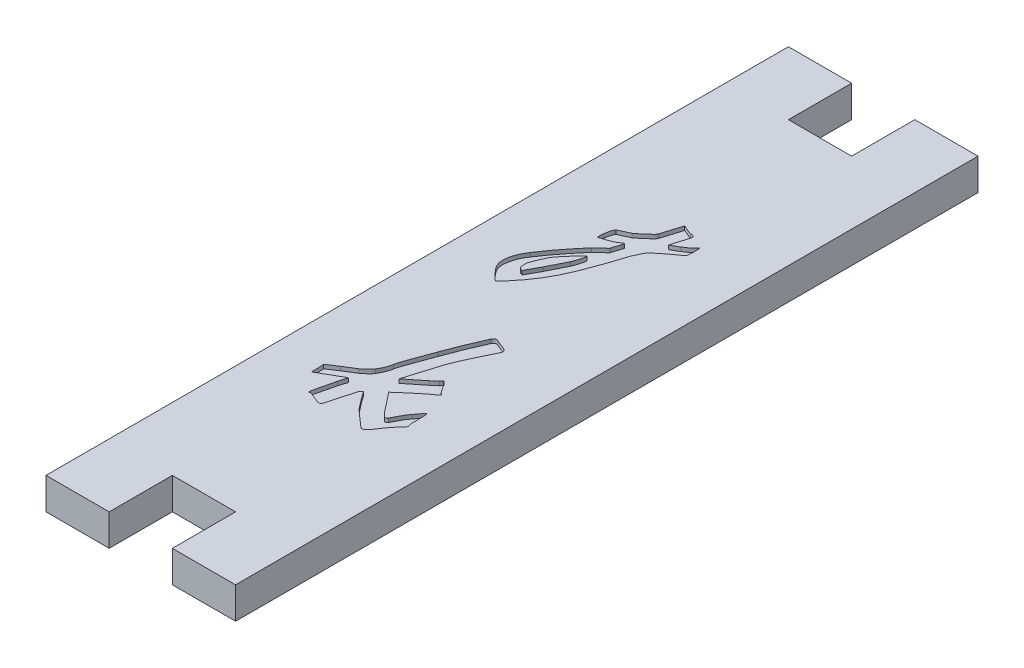
from build123d import *

# Parameters (mm, degrees)
SKETCH_1_W          = 24
SKETCH_1_H          = 94
EXTRUDE_1_DEPTH     = 4
SKETCH_2_W          = 8
SKETCH_2_H          = 8
CUT_EXTRUDE_1_DEPTH = 49.672374095
SKETCH_3_W          = 8
SKETCH_3_H          = 8
CUT_EXTRUDE_2_DEPTH = 49.672374095
THICKEN_START       = 3.5
THICKEN_1_DEPTH     = 0.5
THICKEN_1_2_DEPTH   = 0.5
THICKEN_2_DEPTH     = 0.5


# Read off the part's stored shape, not the designer's step: 除料-厚面1, 厚面1, 除料-厚面2
with BuildPart() as part:
    # 草圖1 → 填料-伸長1 (new body)
    with BuildSketch(Plane(origin=(0, 4, 0), x_dir=(1, 0, 0), z_dir=(0, 1, 0))):
        Rectangle(SKETCH_1_W, SKETCH_1_H)
    extrude(amount=-EXTRUDE_1_DEPTH)

    # 草圖2 → 除料-伸長1 (cut, through all)
    with BuildSketch(Plane.XZ):
        with Locations((0, -43)):
            Rectangle(SKETCH_2_W, SKETCH_2_H)
    extrude(amount=-CUT_EXTRUDE_1_DEPTH, mode=Mode.SUBTRACT)

    # 草圖3 → 除料-伸長2 (cut, through all)
    with BuildSketch(Plane.XZ):
        with Locations((0, 43)):
            Rectangle(SKETCH_3_W, SKETCH_3_H)
    extrude(amount=-CUT_EXTRUDE_2_DEPTH, mode=Mode.SUBTRACT)

    # Thicken 1 outline → Thicken 1 (cut)
    with BuildSketch(Plane(origin=(0, 0, 0), x_dir=(1, 0, 0), z_dir=(0, 1, 0)).offset(THICKEN_START)):
        with BuildLine():
            add(Edge.make_bspline(
                [(-6.355501814, 4.359129383), (-6.396964695, 4.429641782), (-6.490705603, 4.589058979), (-6.607213892, 4.87628821), (-6.682323732, 5.240280014), (-6.686608044, 5.589572198), (-6.659611427, 5.899764075), (-6.613103157, 6.159630598), (-6.552451609, 6.438590561), (-6.468428857, 6.737134296), (-6.357637131, 7.056471783), (-6.197448135, 7.386617717), (-6.009152613, 7.740262462), (-5.857995764, 7.973302873), (-5.778718259, 8.095525998)],
                knots=[0, 0, 0, 0, 0.061464226, 0.138960733, 0.231864936, 0.339186412, 0.400347276, 0.465816726, 0.53751186, 0.614944337, 0.698917175, 0.79125015, 0.890516589, 1, 1, 1, 1], degree=3))
            add(Edge.make_bspline(
                [(-4.875453446, 2.802902056), (-4.887759621, 2.806013638), (-4.919072047, 2.813930899), (-4.971174126, 2.848356063), (-5.043204711, 2.897877043), (-5.167730755, 2.9999646), (-5.345068535, 3.157591897), (-5.560553246, 3.383146756), (-5.778697744, 3.634841778), (-6.000920585, 3.883833782), (-6.195574389, 4.12455497), (-6.305599255, 4.285934536), (-6.355501814, 4.359129383)],
                knots=[0, 0, 0, 0, 0.017504993, 0.044540553, 0.085473388, 0.139153155, 0.267394076, 0.414426075, 0.571210807, 0.729254587, 0.877201495, 1, 1, 1, 1], degree=3))
            add(Edge.make_bspline(
                [(-1.53808948, 7.366384522), (-1.706491203, 7.043403536), (-2.035186776, 6.412991816), (-2.50249307, 5.674043667), (-2.878157375, 5.127060114), (-3.1445816, 4.751525298), (-3.402408942, 4.404780452), (-3.652005084, 4.092565304), (-3.884548983, 3.807649108), (-4.100042025, 3.556253816), (-4.297710464, 3.335420527), (-4.474764512, 3.150800648), (-4.62539466, 3.004800044), (-4.738038152, 2.897753476), (-4.815312887, 2.830715332), (-4.860685257, 2.809731918), (-4.875453446, 2.802902056)],
                knots=[0, 0, 0, 0, 0.192058031, 0.37486923, 0.460670631, 0.54208073, 0.617725062, 0.688547785, 0.752900218, 0.811703363, 0.86318847, 0.909199264, 0.946634941, 0.973709942, 0.991442886, 1, 1, 1, 1], degree=3))
            add(Edge.make_bspline(
                [(0.214026602, 11.704957678), (0.090993183, 11.356147322), (-0.165465463, 10.629064939), (-0.586767093, 9.531147171), (-1.02727134, 8.424166151), (-1.370786044, 7.712829738), (-1.53808948, 7.366384522)],
                knots=[0, 0, 0, 0, 0.236986622, 0.493989915, 0.753555744, 1, 1, 1, 1], degree=3))
            add(Edge.make_bspline(
                [(0.968561064, 14.037484885), (0.849535813, 13.649931707), (0.609597883, 12.868679776), (0.346573374, 12.094893992), (0.214026602, 11.704957678)],
                knots=[0, 0, 0, 0, 0.496066843, 1, 1, 1, 1], degree=3))
            add(Edge.make_bspline(
                [(1.218863362, 14.563482467), (1.176651309, 14.473950261), (1.093845672, 14.298318637), (1.009774868, 14.12328913), (0.968561064, 14.037484885)],
                knots=[0, 0, 0, 0, 0.509772688, 1, 1, 1, 1], degree=3))
            add(Edge.make_bspline(
                [(1.643288996, 15.415961306), (1.567888193, 15.28800753), (1.406365118, 15.013905842), (1.284069825, 14.720123748), (1.218863362, 14.563482467)],
                knots=[0, 0, 0, 0, 0.466811337, 1, 1, 1, 1], degree=3))
            add(Edge.make_bspline(
                [(3.148730351, 16.671100363), (2.984829608, 16.547396061), (2.662950134, 16.304457104), (2.280417729, 15.996859971), (2.003015275, 15.7725801), (1.843084807, 15.631282794), (1.725014504, 15.517538078), (1.666987359, 15.445416041), (1.643288996, 15.415961306)],
                knots=[0, 0, 0, 0, 0.313735315, 0.61613484, 0.750032602, 0.858665321, 0.942278731, 1, 1, 1, 1], degree=3))
            add(Edge.make_bspline(
                [(4.454655381, 17.621523579), (4.227892611, 17.460376924), (3.78900439, 17.148485475), (3.357356414, 16.826650909), (3.148730351, 16.671100363)],
                knots=[0, 0, 0, 0, 0.516675453, 1, 1, 1, 1], degree=3))
            add(Edge.make_bspline(
                [(4.353083434, 19.203143894), (4.365584965, 19.226966086), (4.384919812, 19.263809451), (4.441194248, 19.316120282), (4.480751486, 19.253591234), (4.49918412, 19.138425127), (4.527846222, 18.916669042), (4.528014888, 18.616072783), (4.523019604, 18.283613598), (4.5045242, 18.01242126), (4.495477891, 17.818915499), (4.476010226, 17.719028044), (4.472755816, 17.654202047), (4.458613172, 17.628668963), (4.454655381, 17.621523579)],
                knots=[0, 0, 0, 0, 0.047164453, 0.072944466, 0.096753549, 0.141841484, 0.277220848, 0.451262612, 0.637164929, 0.819339156, 0.896679195, 0.952603895, 0.986736293, 1, 1, 1, 1], degree=3))
            add(Edge.make_bspline(
                [(3.148730351, 18.223700121), (3.279099193, 18.306896722), (3.532031814, 18.468309019), (3.827878365, 18.685784426), (4.041194803, 18.855328752), (4.169839866, 18.977646376), (4.275129682, 19.090159134), (4.328466604, 19.167464705), (4.353083434, 19.203143894)],
                knots=[0, 0, 0, 0, 0.296934427, 0.576091657, 0.704847483, 0.819841485, 0.916850629, 1, 1, 1, 1], degree=3))
            add(Edge.make_bspline(
                [(2.147521161, 17.646916566), (2.323575928, 17.743608954), (2.661240682, 17.929060403), (2.990935068, 18.12832834), (3.148730351, 18.223700121)],
                knots=[0, 0, 0, 0, 0.521389231, 1, 1, 1, 1], degree=3))
            add(Edge.make_bspline(
                [(2.372430472, 18.423216445), (2.338121909, 18.296032144), (2.267944258, 18.035878562), (2.188252887, 17.778478482), (2.147521161, 17.646916566)],
                knots=[0, 0, 0, 0, 0.488881604, 1, 1, 1, 1], degree=3))
            add(Edge.make_bspline(
                [(2.77146312, 19.729141475), (2.738216951, 19.631388811), (2.6675251, 19.423535785), (2.570805342, 19.09827322), (2.471393346, 18.760639468), (2.405059605, 18.534468476), (2.372430472, 18.423216445)],
                knots=[0, 0, 0, 0, 0.22679583, 0.482239539, 0.745317015, 1, 1, 1, 1], degree=3))
            add(Edge.make_bspline(
                [(2.270858525, 20.30592503), (2.307027401, 20.298908891), (2.381325741, 20.284496292), (2.495894074, 20.281269505), (2.60754941, 20.273850249), (2.708123952, 20.247672393), (2.792873311, 20.189554354), (2.833073243, 20.078147149), (2.825147792, 19.919523124), (2.791727394, 19.801004556), (2.77146312, 19.729141475)],
                knots=[0, 0, 0, 0, 0.109552069, 0.225042573, 0.340813598, 0.442248243, 0.532299489, 0.633989637, 0.778071631, 1, 1, 1, 1], degree=3))
            add(Edge.make_bspline(
                [(1.066505441, 20.755743652), (1.078394603, 20.764624321), (1.123491516, 20.798309688), (1.236800829, 20.721551605), (1.383100762, 20.67505288), (1.56203513, 20.588996971), (1.751209944, 20.502808464), (1.936868916, 20.40476984), (2.109745793, 20.328465436), (2.223228075, 20.312588747), (2.270858525, 20.30592503)],
                knots=[0, 0, 0, 0, 0.032378655, 0.122815842, 0.258436103, 0.407565156, 0.570265885, 0.737890626, 0.889988223, 1, 1, 1, 1], degree=3))
            add(Edge.make_bspline(
                [(0.315598549, 18.299879081), (0.325050002, 18.333803159), (0.346409026, 18.410467052), (0.387713096, 18.53664313), (0.434204695, 18.690792698), (0.512295263, 18.932418037), (0.618930546, 19.255254025), (0.737907516, 19.648410199), (0.855311078, 20.022846047), (0.94552102, 20.31282673), (1.005149303, 20.512612015), (1.03836806, 20.623344095), (1.057994607, 20.700857063), (1.064250583, 20.741202013), (1.066505441, 20.755743652)],
                knots=[0, 0, 0, 0, 0.041123604, 0.092933864, 0.155022078, 0.22915871, 0.389484302, 0.552076421, 0.708854994, 0.847774622, 0.906749423, 0.952334963, 0.982819963, 1, 1, 1, 1], degree=3))
            add(Edge.make_bspline(
                [(-1.440145103, 16.645707376), (-1.387014209, 16.686917319), (-1.258206121, 16.786824805), (-1.03600765, 16.95451716), (-0.772139069, 17.159164741), (-0.49982224, 17.396656781), (-0.229031634, 17.636599328), (0.014427265, 17.868413205), (0.215397355, 18.077474031), (0.285876649, 18.233908803), (0.315598549, 18.299879081)],
                knots=[0, 0, 0, 0, 0.082974002, 0.201158344, 0.343550518, 0.494880313, 0.647053791, 0.789531943, 0.911243287, 1, 1, 1, 1], degree=3))
            Line((-1.440145103, 16.645707376), (-2.84401451, 15.992744861))
            add(Edge.make_bspline(
                [(-3.195888755, 14.788391778), (-3.177074742, 14.897349007), (-3.13932888, 15.115945898), (-3.074192657, 15.435897913), (-2.99026329, 15.737230253), (-2.890925619, 15.910785383), (-2.84401451, 15.992744861)],
                knots=[0, 0, 0, 0, 0.262525929, 0.526696136, 0.776487521, 1, 1, 1, 1], degree=3))
            add(Edge.make_bspline(
                [(-3.221281741, 14.012091898), (-3.22534503, 14.143989053), (-3.233333674, 14.403305985), (-3.208225891, 14.661515935), (-3.195888755, 14.788391778)],
                knots=[0, 0, 0, 0, 0.50863302, 1, 1, 1, 1], degree=3))
            add(Edge.make_bspline(
                [(-1.240628779, 14.788391778), (-1.327580877, 14.731628596), (-1.506171083, 14.615043161), (-1.802148162, 14.483408633), (-2.109435492, 14.372118835), (-2.405791492, 14.263409521), (-2.680379731, 14.17651472), (-2.910767377, 14.103183989), (-3.087990448, 14.056261978), (-3.183887737, 14.024483527), (-3.221281741, 14.012091898)],
                knots=[0, 0, 0, 0, 0.145681397, 0.299213836, 0.453505669, 0.605032546, 0.742561932, 0.858092831, 0.944664992, 1, 1, 1, 1], degree=3))
            add(Edge.make_bspline(
                [(-0.812575574, 14.839177751), (-0.800655951, 14.872439462), (-0.780708314, 14.928103344), (-0.767234849, 15.025221683), (-0.846806913, 15.043046994), (-0.932610841, 14.985166609), (-1.071759688, 14.906725782), (-1.178284056, 14.832079469), (-1.240628779, 14.788391778)],
                knots=[0, 0, 0, 0, 0.159084507, 0.266229873, 0.319258042, 0.45601908, 0.681628342, 1, 1, 1, 1], degree=3))
            add(Edge.make_bspline(
                [(-1.189842805, 13.660217654), (-1.178801259, 13.692814769), (-1.151929216, 13.772147048), (-1.110851983, 13.909196174), (-1.061598309, 14.072176342), (-1.012205552, 14.249481274), (-0.959481422, 14.426572001), (-0.904971769, 14.591590611), (-0.849019562, 14.72547937), (-0.823083673, 14.806394462), (-0.812575574, 14.839177751)],
                knots=[0, 0, 0, 0, 0.083373258, 0.202907239, 0.346569204, 0.495855602, 0.648776739, 0.794219706, 0.916626742, 1, 1, 1, 1], degree=3))
            add(Edge.make_bspline(
                [(-2.415961306, 12.481257557), (-2.375673558, 12.528002754), (-2.283400562, 12.635065557), (-2.111086984, 12.789836765), (-1.916511164, 12.958858232), (-1.718707164, 13.132049105), (-1.530781981, 13.294723678), (-1.368397809, 13.435913814), (-1.232778151, 13.541823636), (-1.201260404, 13.628733679), (-1.189842805, 13.660217654)],
                knots=[0, 0, 0, 0, 0.108147374, 0.247695208, 0.405516853, 0.560345802, 0.709190176, 0.840088713, 0.942070641, 1, 1, 1, 1], degree=3))
            add(Edge.make_bspline(
                [(-5.778718259, 8.095525998), (-5.614963707, 8.345918195), (-5.284236811, 8.851622817), (-4.756748484, 9.581410264), (-4.229891658, 10.274440351), (-3.802282785, 10.816175608), (-3.482573731, 11.212484586), (-3.259201189, 11.474774792), (-3.061985835, 11.720543896), (-2.877170248, 11.934111647), (-2.720280366, 12.121611227), (-2.589574808, 12.272839433), (-2.491294281, 12.388657066), (-2.437652714, 12.454594134), (-2.415961306, 12.481257557)],
                knots=[0, 0, 0, 0, 0.162259993, 0.327708409, 0.488268098, 0.634438927, 0.702044496, 0.764438419, 0.821291446, 0.872938895, 0.917615173, 0.953896129, 0.981356662, 1, 1, 1, 1], degree=3))
        make_face()
    extrude(amount=THICKEN_1_DEPTH, mode=Mode.SUBTRACT)

    # Thicken 1 2 outline → Thicken 1 2 (add)
    with BuildSketch(Plane(origin=(0, 0, 0), x_dir=(1, 0, 0), z_dir=(0, 1, 0)).offset(THICKEN_START)):
        with BuildLine():
            add(Edge.make_bspline(
                [(-2.216444982, 9.648125756), (-2.17552934, 9.749311061), (-2.093896964, 9.951189767), (-1.990875365, 10.257095254), (-1.903786067, 10.549079328), (-1.830334109, 10.811553984), (-1.780396913, 11.026608125), (-1.764589444, 11.180698198), (-1.767781094, 11.260543983), (-1.776784264, 11.306397188), (-1.814437117, 11.303229237), (-1.829493392, 11.289416528), (-1.839177751, 11.280532044)],
                knots=[0, 0, 0, 0, 0.183182449, 0.365474372, 0.541418149, 0.695048749, 0.821642748, 0.91536267, 0.945876205, 0.96586673, 0.978045111, 1, 1, 1, 1], degree=3))
            add(Edge.make_bspline(
                [(-1.839177751, 11.280532044), (-1.996406467, 11.114905306), (-2.306156211, 10.788610969), (-2.615509659, 10.461940887), (-2.76783555, 10.301088271)],
                knots=[0, 0, 0, 0, 0.507599178, 1, 1, 1, 1], degree=3))
            add(Edge.make_bspline(
                [(-2.76783555, 10.301088271), (-2.892802155, 10.157551672), (-3.142308325, 9.87096897), (-3.444873217, 9.511018872), (-3.674563926, 9.232179281), (-3.820755428, 9.03466222), (-3.944525778, 8.850762012), (-4.015089066, 8.729498799), (-4.048367594, 8.672309553)],
                knots=[0, 0, 0, 0, 0.275105899, 0.549271699, 0.679762958, 0.797229414, 0.904370858, 1, 1, 1, 1], degree=3))
            add(Edge.make_bspline(
                [(-4.048367594, 8.672309553), (-4.141649227, 8.48729224), (-4.319884754, 8.133775079), (-4.501019958, 7.690568578), (-4.621598805, 7.373354236), (-4.687613528, 7.177436459), (-4.752248882, 7.023941721), (-4.785096514, 6.93120201), (-4.799274486, 6.891172914)],
                knots=[0, 0, 0, 0, 0.321193128, 0.613711661, 0.741879837, 0.847454188, 0.934156891, 1, 1, 1, 1], degree=3))
            add(Edge.make_bspline(
                [(-4.799274486, 6.891172914), (-4.819894294, 6.814240967), (-4.866008208, 6.642191199), (-4.851910432, 6.370106628), (-4.831119371, 6.121450713), (-4.808265312, 5.970940226), (-4.799274486, 5.911729141)],
                knots=[0, 0, 0, 0, 0.240563843, 0.537994352, 0.818246184, 1, 1, 1, 1], degree=3))
            add(Edge.make_bspline(
                [(-4.799274486, 5.911729141), (-4.796520444, 5.890182721), (-4.790636227, 5.844147173), (-4.731145793, 5.787996809), (-4.654163097, 5.730200661), (-4.586251523, 5.702193864), (-4.548972189, 5.686819831)],
                knots=[0, 0, 0, 0, 0.178895712, 0.382224149, 0.660878528, 1, 1, 1, 1], degree=3))
            add(Edge.make_bspline(
                [(-4.548972189, 5.686819831), (-4.513025553, 5.671340454), (-4.440097024, 5.639935896), (-4.363105239, 5.620497857), (-4.324062878, 5.610640871)],
                knots=[0, 0, 0, 0, 0.492902246, 1, 1, 1, 1], degree=3))
            add(Edge.make_bspline(
                [(-4.324062878, 5.610640871), (-4.160940342, 5.902670855), (-3.845329812, 6.467692345), (-3.54197277, 7.039384228), (-3.395405079, 7.315598549)],
                knots=[0, 0, 0, 0, 0.516847572, 1, 1, 1, 1], degree=3))
            add(Edge.make_bspline(
                [(-3.395405079, 7.315598549), (-3.277899134, 7.541606759), (-3.043638989, 7.992177294), (-2.757897716, 8.549454429), (-2.539525206, 8.967447546), (-2.40538467, 9.235953441), (-2.298747867, 9.456667935), (-2.241467453, 9.589917009), (-2.216444982, 9.648125756)],
                knots=[0, 0, 0, 0, 0.292343824, 0.582817378, 0.718745688, 0.833560201, 0.927292161, 1, 1, 1, 1], degree=3))
        make_face()
    extrude(amount=THICKEN_1_2_DEPTH)

    # 除料-厚面2 outline → 除料-厚面2 (cut)
    with BuildSketch(Plane(origin=(0, 0, 0), x_dir=(1, 0, 0), z_dir=(0, 1, 0)).offset(THICKEN_START)):
        with BuildLine():
            add(Edge.make_bspline(
                [(5.5356711, -18.544135429), (5.547968059, -18.583804787), (5.572561976, -18.663143503), (5.540660015, -18.785615227), (5.480231433, -18.891841458), (5.401188216, -18.984003978), (5.311411449, -19.061392824), (5.234870389, -19.132193904), (5.16420893, -19.172065994), (5.143349561, -19.207472111), (5.136638452, -19.218863362)],
                knots=[0, 0, 0, 0, 0.145364246, 0.290728492, 0.433450117, 0.58021274, 0.720506838, 0.855127393, 0.953389968, 1, 1, 1, 1], degree=3))
            add(Edge.make_bspline(
                [(5.361547763, -16.160822249), (5.369385861, -16.182428757), (5.388161469, -16.234185615), (5.40367647, -16.330914366), (5.418674597, -16.455430536), (5.425123142, -16.666315501), (5.436560653, -16.959966673), (5.437015411, -17.328922504), (5.44168797, -17.701339385), (5.443607339, -18.001377735), (5.456956576, -18.220615373), (5.474636643, -18.35387452), (5.496751639, -18.461228845), (5.523897835, -18.519055915), (5.5356711, -18.544135429)],
                knots=[0, 0, 0, 0, 0.028664585, 0.068663979, 0.121884644, 0.185408308, 0.332021736, 0.489147652, 0.646273568, 0.797379407, 0.864007013, 0.920413077, 0.965483269, 1, 1, 1, 1], degree=3))
            add(Edge.make_bspline(
                [(4.483675937, -17.165659008), (4.539715493, -17.097062738), (4.65038235, -16.961598895), (4.806082974, -16.756584919), (4.941105903, -16.557701049), (5.061994644, -16.386449973), (5.16310355, -16.250152411), (5.229333122, -16.161127046), (5.310163109, -16.103931662), (5.344198012, -16.14161345), (5.361547763, -16.160822249)],
                knots=[0, 0, 0, 0, 0.189123782, 0.373481446, 0.549684893, 0.701564453, 0.823440644, 0.90578271, 0.951971466, 1, 1, 1, 1], degree=3))
            add(Edge.make_bspline(
                [(3.406287787, -19.019347037), (3.478595607, -18.886813222), (3.638466542, -18.593783991), (3.869508102, -18.118055289), (4.135510276, -17.617370645), (4.369347878, -17.313988727), (4.483675937, -17.165659008)],
                knots=[0, 0, 0, 0, 0.210772315, 0.466012763, 0.738922552, 1, 1, 1, 1], degree=3))
            add(Edge.make_bspline(
                [(3.07980653, -19.197097944), (3.115091004, -19.195143664), (3.182532553, -19.191408318), (3.277484633, -19.159187903), (3.352331468, -19.097615044), (3.388121548, -19.045698637), (3.406287787, -19.019347037)],
                knots=[0, 0, 0, 0, 0.270606257, 0.517227637, 0.754955612, 1, 1, 1, 1], degree=3))
            add(Edge.make_bspline(
                [(2.778718259, -18.943168077), (2.790684202, -18.955390927), (2.82183301, -18.987208494), (2.884858184, -19.041719539), (2.975025686, -19.111925), (3.042437055, -19.166721513), (3.07980653, -19.197097944)],
                knots=[0, 0, 0, 0, 0.130157595, 0.338816094, 0.633472883, 1, 1, 1, 1], degree=3))
            add(Edge.make_bspline(
                [(0.573155985, -16.186215236), (0.701681981, -16.340700274), (0.948450457, -16.637309821), (1.299877626, -17.07114501), (1.613738675, -17.478018858), (1.890398551, -17.857599542), (2.144639158, -18.193498109), (2.369510066, -18.489998793), (2.581387391, -18.732648494), (2.716692946, -18.876997269), (2.778718259, -18.943168077)],
                knots=[0, 0, 0, 0, 0.170674282, 0.327692714, 0.474149794, 0.60704179, 0.726580859, 0.831963829, 0.922970671, 1, 1, 1, 1], degree=3))
            add(Edge.make_bspline(
                [(3.355501814, -13.828295042), (3.342030923, -13.83651887), (3.305000127, -13.859125754), (3.240152605, -13.913962678), (3.142105047, -13.986839277), (2.968232723, -14.134145568), (2.698876078, -14.352756504), (2.334509161, -14.657066459), (1.923631028, -15.006832944), (1.483727636, -15.388205661), (1.026055695, -15.781383384), (0.723868826, -16.051498085), (0.573155985, -16.186215236)],
                knots=[0, 0, 0, 0, 0.01296538, 0.035641172, 0.069654861, 0.113453605, 0.222950467, 0.354981079, 0.503825744, 0.666691831, 0.833765705, 1, 1, 1, 1], degree=3))
            add(Edge.make_bspline(
                [(3.906892382, -13.429262394), (3.862722065, -13.469831213), (3.770260829, -13.554753472), (3.624364177, -13.665942767), (3.484021511, -13.757936244), (3.394454318, -13.806970285), (3.355501814, -13.828295042)],
                knots=[0, 0, 0, 0, 0.26342795, 0.551430815, 0.804918602, 1, 1, 1, 1], degree=3))
            add(Edge.make_bspline(
                [(4.23337364, -13.128174123), (4.177106583, -13.183201713), (4.071217484, -13.286758257), (3.959326871, -13.383790756), (3.906892382, -13.429262394)],
                knots=[0, 0, 0, 0, 0.531377234, 1, 1, 1, 1], degree=3))
            add(Edge.make_bspline(
                [(4.106408706, -13.051995163), (4.12918824, -13.066832463), (4.170576391, -13.093790362), (4.213896425, -13.117509645), (4.23337364, -13.128174123)],
                knots=[0, 0, 0, 0, 0.550387815, 1, 1, 1, 1], degree=3))
            add(Edge.make_bspline(
                [(3.932285369, -12.903264813), (3.951036105, -12.9244879), (4.001914575, -12.982074877), (4.065964023, -13.024932363), (4.106408706, -13.051995163)],
                knots=[0, 0, 0, 0, 0.368539718, 1, 1, 1, 1], degree=3))
            add(Edge.make_bspline(
                [(3.330108827, -11.974607013), (3.377686217, -12.067663532), (3.475999637, -12.259954543), (3.630624378, -12.48137064), (3.760084845, -12.644242177), (3.836590091, -12.749344839), (3.891837132, -12.833187466), (3.920361578, -12.882606616), (3.932285369, -12.903264813)],
                knots=[0, 0, 0, 0, 0.282542076, 0.583841976, 0.728473626, 0.845624376, 0.935467891, 1, 1, 1, 1], degree=3))
            add(Edge.make_bspline(
                [(3.00362757, -11.597339782), (3.067262445, -11.651419603), (3.195471209, -11.760377261), (3.285011021, -11.90284927), (3.330108827, -11.974607013)],
                knots=[0, 0, 0, 0, 0.49633795, 1, 1, 1, 1], degree=3))
            add(Edge.make_bspline(
                [(2.829504232, -11.474002418), (2.857636614, -11.491684744), (2.917939605, -11.529587582), (2.973817613, -11.573769493), (3.00362757, -11.597339782)],
                knots=[0, 0, 0, 0, 0.466517187, 1, 1, 1, 1], degree=3))
            add(Edge.make_bspline(
                [(2.579201935, -11.775090689), (2.626368394, -11.725312253), (2.716338669, -11.630359616), (2.793021829, -11.524408975), (2.829504232, -11.474002418)],
                knots=[0, 0, 0, 0, 0.524244907, 1, 1, 1, 1], degree=3))
            add(Edge.make_bspline(
                [(1.875453446, -12.373639661), (1.941133162, -12.32333156), (2.072947131, -12.222367199), (2.259209988, -12.066042658), (2.430160754, -11.918989671), (2.532428193, -11.820250649), (2.579201935, -11.775090689)],
                knots=[0, 0, 0, 0, 0.268451242, 0.5387603, 0.789044228, 1, 1, 1, 1], degree=3))
            add(Edge.make_bspline(
                [(-0.22853688, -14.056831923), (-0.147381499, -13.991707441), (0.028928238, -13.850224767), (0.303318166, -13.623710318), (0.596346205, -13.383303044), (0.893298817, -13.143221692), (1.184872859, -12.916989042), (1.447945505, -12.699022966), (1.675552873, -12.518666795), (1.815938132, -12.416817804), (1.875453446, -12.373639661)],
                knots=[0, 0, 0, 0, 0.115842547, 0.251667465, 0.396111568, 0.537813394, 0.676784031, 0.806926323, 0.918147813, 1, 1, 1, 1], degree=3))
            add(Edge.make_bspline(
                [(0.99758162, -10.019347037), (0.968448362, -10.114838997), (0.902476288, -10.331079919), (0.79509321, -10.69343148), (0.660296072, -11.128578221), (0.50179034, -11.629600519), (0.329841235, -12.182978935), (0.152169582, -12.778662955), (-0.035846491, -13.406055147), (-0.163364039, -13.836722494), (-0.22853688, -14.056831923)],
                knots=[0, 0, 0, 0, 0.070980519, 0.160734924, 0.268690381, 0.394851359, 0.534346701, 0.680671107, 0.836794453, 1, 1, 1, 1], degree=3))
            add(Edge.make_bspline(
                [(2.350665054, -6.758162031), (2.218725671, -7.03807776), (1.950572428, -7.606977722), (1.637334877, -8.325148035), (1.398854771, -8.895189357), (1.243036894, -9.295217854), (1.112219759, -9.667376214), (1.034647583, -9.905544272), (0.99758162, -10.019347037)],
                knots=[0, 0, 0, 0, 0.262722139, 0.533955759, 0.665128141, 0.787336449, 0.898383937, 1, 1, 1, 1], degree=3))
            add(Edge.make_bspline(
                [(3.330108827, -4.752116082), (3.1591586, -5.089877312), (2.823088772, -5.753879695), (2.506307634, -6.427295718), (2.350665054, -6.758162031)],
                knots=[0, 0, 0, 0, 0.508674725, 1, 1, 1, 1], degree=3))
            add(Edge.make_bspline(
                [(3.3808948, -4.552599758), (3.379532187, -4.587027712), (3.376758839, -4.657099471), (3.345837674, -4.720079611), (3.330108827, -4.752116082)],
                knots=[0, 0, 0, 0, 0.49132423, 1, 1, 1, 1], degree=3))
            add(Edge.make_bspline(
                [(3.22853688, -4.226118501), (3.273882824, -4.271386415), (3.364366861, -4.36171475), (3.375393931, -4.489068937), (3.3808948, -4.552599758)],
                knots=[0, 0, 0, 0, 0.501148551, 1, 1, 1, 1], degree=3))
            add(Edge.make_bspline(
                [(1.824667473, -3.623941959), (1.860608156, -3.643981174), (1.949159094, -3.693353951), (2.11244769, -3.756783368), (2.309636897, -3.824291055), (2.513630872, -3.916570064), (2.722247687, -3.99568522), (2.918213804, -4.076169935), (3.09461776, -4.13631), (3.188252627, -4.199103177), (3.22853688, -4.226118501)],
                knots=[0, 0, 0, 0, 0.080605255, 0.198595864, 0.342607514, 0.489229858, 0.637149771, 0.779788916, 0.905259233, 1, 1, 1, 1], degree=3))
            add(Edge.make_bspline(
                [(1.222490931, -3.874244256), (1.248243673, -3.825358212), (1.303570743, -3.720331662), (1.459233746, -3.620719307), (1.645253116, -3.553812466), (1.765712214, -3.600897524), (1.824667473, -3.623941959)],
                knots=[0, 0, 0, 0, 0.22456463, 0.482453608, 0.746701726, 1, 1, 1, 1], degree=3))
            add(Edge.make_bspline(
                [(-0.707376058, -8.61547763), (-0.606145347, -8.342075002), (-0.404714856, -7.798054071), (-0.101403137, -6.997236537), (0.203255771, -6.238188861), (0.453303628, -5.643408802), (0.6410282, -5.207523811), (0.76970346, -4.917372125), (0.881542042, -4.651769219), (0.981050637, -4.415619109), (1.067948187, -4.217048733), (1.13155011, -4.05931901), (1.181373012, -3.950417896), (1.211440974, -3.894715025), (1.222490931, -3.874244256)],
                knots=[0, 0, 0, 0, 0.170811492, 0.339883445, 0.501697302, 0.649981913, 0.717889758, 0.77975253, 0.835939392, 0.886730889, 0.929894069, 0.962918803, 0.986372684, 1, 1, 1, 1], degree=3))
            add(Edge.make_bspline(
                [(-2.162031439, -12.827085852), (-2.143738828, -12.742172844), (-2.101020468, -12.543877238), (-1.998527639, -12.21251487), (-1.864135124, -11.7998095), (-1.688801092, -11.310029272), (-1.481739994, -10.741064278), (-1.246859026, -10.097875098), (-0.984247672, -9.381347445), (-0.802698827, -8.879155191), (-0.707376058, -8.61547763)],
                knots=[0, 0, 0, 0, 0.058428053, 0.136445833, 0.23319761, 0.350551267, 0.486461293, 0.640654987, 0.811324815, 1, 1, 1, 1], degree=3))
            add(Edge.make_bspline(
                [(-2.811366385, -14.481257557), (-2.747947276, -14.373321977), (-2.605269249, -14.130492392), (-2.420973951, -13.723536814), (-2.240085175, -13.285989285), (-2.187158053, -12.974813428), (-2.162031439, -12.827085852)],
                knots=[0, 0, 0, 0, 0.209833992, 0.472076965, 0.749373903, 1, 1, 1, 1], degree=3))
            add(Edge.make_bspline(
                [(-3.892382104, -15.507859734), (-3.867832472, -15.493886227), (-3.800540739, -15.455584168), (-3.692302041, -15.363192673), (-3.54849391, -15.246346981), (-3.386193445, -15.104955066), (-3.216513077, -14.950513133), (-3.053799022, -14.78879612), (-2.91556617, -14.633989628), (-2.843159455, -14.527858627), (-2.811366385, -14.481257557)],
                knots=[0, 0, 0, 0, 0.056463674, 0.15476967, 0.283713139, 0.427871238, 0.585506223, 0.742992425, 0.887150525, 1, 1, 1, 1], degree=3))
            add(Edge.make_bspline(
                [(-5.296251511, -16.38573156), (-5.13409652, -16.283153366), (-4.824519909, -16.087317212), (-4.454174141, -15.849345729), (-4.192496525, -15.692044044), (-4.052660504, -15.600263651), (-3.954486782, -15.546641086), (-3.908039573, -15.517637062), (-3.892382104, -15.507859734)],
                knots=[0, 0, 0, 0, 0.347642767, 0.663698777, 0.797461365, 0.900799761, 0.966559353, 1, 1, 1, 1], degree=3))
            Line((-5.296251511, -16.38573156), (-6.598548972, -17.238210399))
            Line((-6.598548972, -17.238210399), (-6.522370012, -18.8452237))
            add(Edge.make_bspline(
                [(-5.169286578, -18.065296252), (-5.387364832, -18.187897414), (-5.841183123, -18.443028994), (-6.289491928, -18.70772497), (-6.522370012, -18.8452237)],
                knots=[0, 0, 0, 0, 0.48054091, 1, 1, 1, 1], degree=3))
            add(Edge.make_bspline(
                [(-3.642079807, -17.191051995), (-3.666443913, -17.202811227), (-3.729866652, -17.23342194), (-3.84247263, -17.303847993), (-4.005691823, -17.389357234), (-4.280155049, -17.556570051), (-4.673950705, -17.782479554), (-4.999964744, -17.96862035), (-5.169286578, -18.065296252)],
                knots=[0, 0, 0, 0, 0.04609035, 0.119978801, 0.226086754, 0.360066255, 0.667637763, 1, 1, 1, 1], degree=3))
            add(Edge.make_bspline(
                [(-3.866989117, -18.243047158), (-3.845887631, -18.155832513), (-3.806156845, -17.991621029), (-3.740304563, -17.762808642), (-3.677588229, -17.565007436), (-3.606541428, -17.402224244), (-3.559598545, -17.288381906), (-3.528265186, -17.198832267), (-3.583274676, -17.150002724), (-3.618790512, -17.174794765), (-3.642079807, -17.191051995)],
                knots=[0, 0, 0, 0, 0.22147266, 0.416998248, 0.586860024, 0.735380441, 0.847872067, 0.907853086, 0.939575219, 1, 1, 1, 1], degree=3))
            add(Edge.make_bspline(
                [(-4.516324063, -21.101571947), (-4.515522053, -21.079765993), (-4.513505772, -21.02494502), (-4.49613994, -20.92854215), (-4.475552213, -20.799994025), (-4.428947285, -20.57963402), (-4.353440847, -20.263237196), (-4.253412058, -19.85230728), (-4.145207128, -19.417730419), (-4.042929388, -18.984704436), (-3.955814138, -18.591500219), (-3.894083948, -18.349337892), (-3.866989117, -18.243047158)],
                knots=[0, 0, 0, 0, 0.022296939, 0.056055326, 0.099975201, 0.155521677, 0.286325835, 0.43271439, 0.588100464, 0.744399397, 0.887810891, 1, 1, 1, 1], degree=3))
            add(Edge.make_bspline(
                [(-4.418379686, -21.224909311), (-4.433029564, -21.231603945), (-4.458852791, -21.243404524), (-4.497995747, -21.216606366), (-4.513090003, -21.165651097), (-4.515102175, -21.125782229), (-4.516324063, -21.101571947)],
                knots=[0, 0, 0, 0, 0.225293805, 0.397123626, 0.633904646, 1, 1, 1, 1], degree=3))
            add(Edge.make_bspline(
                [(-4.291414752, -21.177750907), (-4.313666134, -21.191920898), (-4.352788074, -21.216834298), (-4.398616911, -21.222476307), (-4.418379686, -21.224909311)],
                knots=[0, 0, 0, 0, 0.568769893, 1, 1, 1, 1], degree=3))
            Line((-4.291414752, -21.177750907), (-2.989117291, -21.703748489))
            Line((-2.989117291, -21.703748489), (-2.561064087, -21.801692866))
            add(Edge.make_bspline(
                [(-2.46311971, -21.729141475), (-2.480559371, -21.756535522), (-2.50518234, -21.795213037), (-2.54844344, -21.800229425), (-2.561064087, -21.801692866)],
                knots=[0, 0, 0, 0, 0.708268008, 1, 1, 1, 1], degree=3))
            add(Edge.make_bspline(
                [(-2.162031439, -20.749697703), (-2.177697532, -20.819836147), (-2.20691613, -20.950650324), (-2.248165907, -21.131795842), (-2.293305936, -21.282291317), (-2.34244848, -21.435242064), (-2.396014819, -21.582655231), (-2.44327492, -21.685821402), (-2.46311971, -21.729141475)],
                knots=[0, 0, 0, 0, 0.209932756, 0.391542486, 0.542425317, 0.668638243, 0.86085928, 1, 1, 1, 1], degree=3))
            add(Edge.make_bspline(
                [(-1.38210399, -17.967351874), (-1.42656344, -18.129461338), (-1.512537817, -18.442943856), (-1.641873188, -18.896604885), (-1.754758665, -19.321388846), (-1.867700848, -19.707173872), (-1.964866107, -20.048046249), (-2.043537533, -20.33528488), (-2.109245024, -20.562154685), (-2.146370993, -20.694058248), (-2.162031439, -20.749697703)],
                knots=[0, 0, 0, 0, 0.174515956, 0.337473827, 0.489747914, 0.630803758, 0.754788078, 0.857736936, 0.93999071, 1, 1, 1, 1], degree=3))
            add(Edge.make_bspline(
                [(-1.081015719, -17.717049577), (-1.111819855, -17.739333276), (-1.170405624, -17.781714195), (-1.243870582, -17.851706714), (-1.312529193, -17.913950771), (-1.358872645, -17.949521), (-1.38210399, -17.967351874)],
                knots=[0, 0, 0, 0, 0.290717385, 0.552909562, 0.775879618, 1, 1, 1, 1], degree=3))
            add(Edge.make_bspline(
                [(-0.00362757, -19.197097944), (-0.096763414, -19.076202165), (-0.286276374, -18.830203247), (-0.570482901, -18.460169693), (-0.837210787, -18.087888271), (-1.001973242, -17.837276878), (-1.081015719, -17.717049577)],
                knots=[0, 0, 0, 0, 0.250004905, 0.508710368, 0.764310687, 1, 1, 1, 1], degree=3))
            add(Edge.make_bspline(
                [(0.598548972, -19.973397823), (0.497896816, -19.8454482), (0.295411048, -19.588047079), (0.096438954, -19.327920248), (-0.00362757, -19.197097944)],
                knots=[0, 0, 0, 0, 0.497082621, 1, 1, 1, 1], degree=3))
            Line((0.598548972, -19.973397823), (2.753325272, -21.877871826))
            Line((2.753325272, -21.877871826), (2.905683192, -21.877871826))
            add(Edge.make_bspline(
                [(3.181378476, -21.776299879), (3.139395139, -21.805923582), (3.056505768, -21.864410835), (2.955519884, -21.873423876), (2.905683192, -21.877871826)],
                knots=[0, 0, 0, 0, 0.50649844, 1, 1, 1, 1], degree=3))
            add(Edge.make_bspline(
                [(3.707376058, -21.15235792), (3.664949446, -21.216032211), (3.58344196, -21.338359477), (3.448236036, -21.502090077), (3.311299215, -21.642606403), (3.223688468, -21.732761258), (3.181378476, -21.776299879)],
                knots=[0, 0, 0, 0, 0.280503063, 0.538885822, 0.777313425, 1, 1, 1, 1], degree=3))
            add(Edge.make_bspline(
                [(4.860943168, -19.570737606), (4.836526315, -19.598354767), (4.771073581, -19.672386367), (4.661669147, -19.813998279), (4.513794317, -19.997121135), (4.353449121, -20.217061977), (4.181348807, -20.454611752), (4.005760738, -20.692934541), (3.850832457, -20.928806548), (3.753204476, -21.080942454), (3.707376058, -21.15235792)],
                knots=[0, 0, 0, 0, 0.056438354, 0.151290771, 0.27390794, 0.416859736, 0.567973353, 0.723172615, 0.870051999, 1, 1, 1, 1], degree=3))
            add(Edge.make_bspline(
                [(5.136638452, -19.218863362), (5.109966379, -19.273400582), (5.068167312, -19.358868439), (4.994129009, -19.45363307), (4.923007594, -19.50927839), (4.883443258, -19.548456921), (4.860943168, -19.570737606)],
                knots=[0, 0, 0, 0, 0.402352164, 0.630545104, 0.789892377, 1, 1, 1, 1], degree=3))
        make_face()
    extrude(amount=THICKEN_2_DEPTH, mode=Mode.SUBTRACT)


solid = part.part
